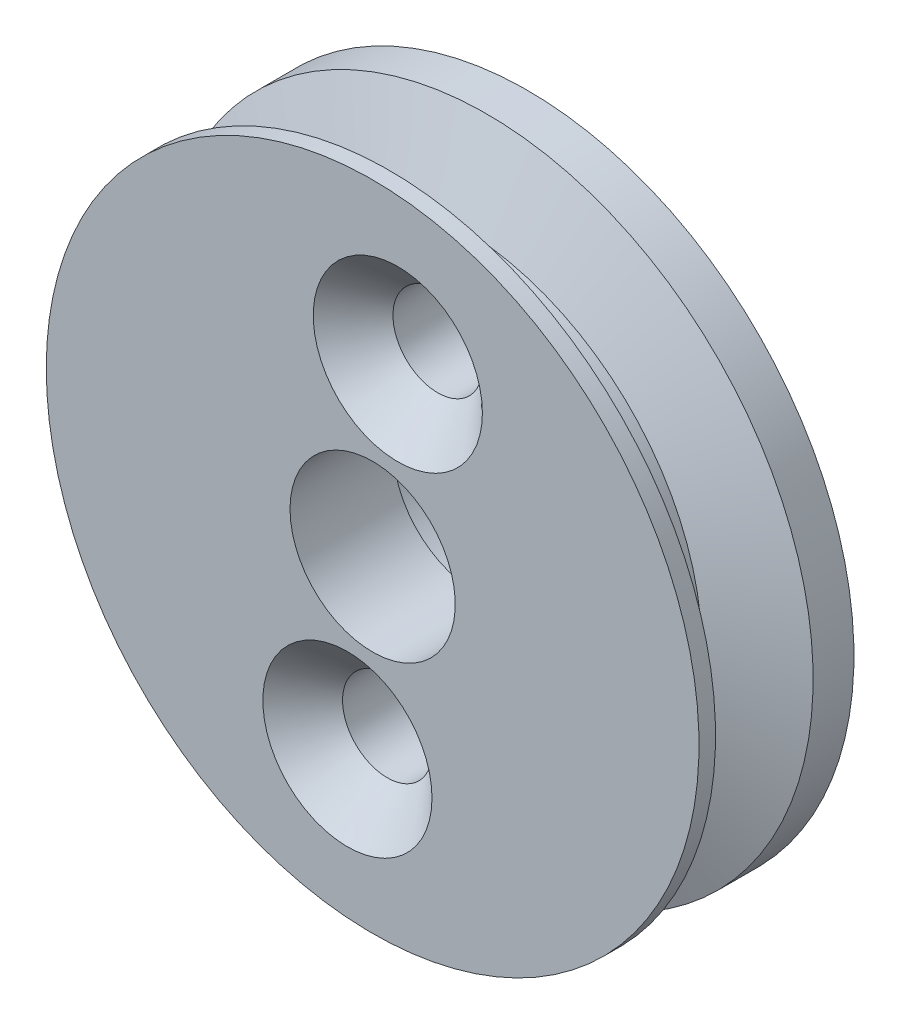
from build123d import *

# Parameters (mm, degrees)
CSK_FOR_M5_FLAT_HEAD_MACHINE_SCREW1_D           = 5.5
CSK_FOR_M5_FLAT_HEAD_MACHINE_SCREW1_CSINK_D     = 10.4
CSK_FOR_M5_FLAT_HEAD_MACHINE_SCREW1_CSINK_ANGLE = 90


with BuildPart() as part:
    # Sketch1 → Revolve1 (revolve)
    with BuildSketch(Plane(origin=(0, 0, 0), x_dir=(0, 0, -1), z_dir=(1, 0, 0))):
        Polygon((0, 7.14375), (-3.175, 7.14375), (-3.175, 5.08), (-9.525, 5.08), (-9.525, 20.066), (-8.509, 20.066), (-6.683325258, 15.049999872), (-4.334674804, 15.049999872), (-2.509000062, 20.066), (0, 20.066), align=None)
    revolve(axis=Axis((0, 0, 0), (0, 0, 1)))

    # CSK for M5 Flat Head Machine Screw1 (through all)
    with Locations(Plane.XY.offset(9.525)):
        with Locations((1.549240167, 11.023416574), (-1.549240167, -11.023416574)):
            CounterSinkHole(CSK_FOR_M5_FLAT_HEAD_MACHINE_SCREW1_D / 2, CSK_FOR_M5_FLAT_HEAD_MACHINE_SCREW1_CSINK_D / 2, counter_sink_angle=CSK_FOR_M5_FLAT_HEAD_MACHINE_SCREW1_CSINK_ANGLE)


solid = part.part
